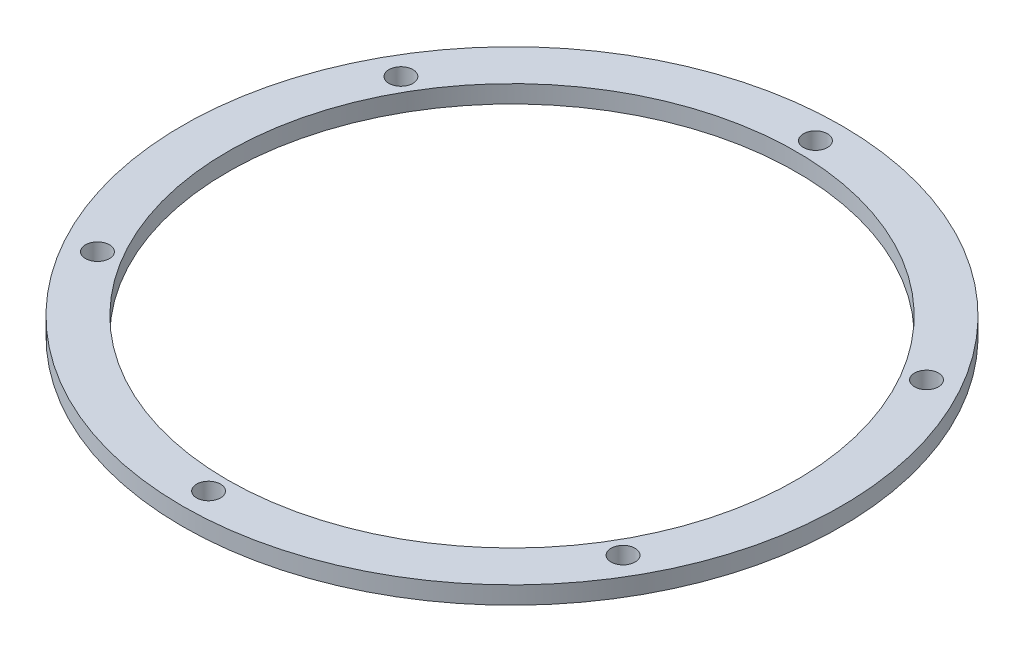
from build123d import *

# Parameters (mm, degrees)
SKETCH1_R           = 59.309
SKETCH1_R_2         = 51.181
BOSS_EXTRUDE1_DEPTH = 3.175
CUT_EXTRUDE1_REACH  = 85.936
SKETCH2_R           = 2.159
CIRPATTERN1_COUNT   = 6


with BuildPart() as part:
    # Sketch1 → Boss-Extrude1 (new body)
    with BuildSketch(Plane(origin=(0, 0, 0), x_dir=(1, 0, 0), z_dir=(0, 1, 0))):
        Circle(SKETCH1_R)
        Circle(SKETCH1_R_2, mode=Mode.SUBTRACT)
    extrude(amount=BOSS_EXTRUDE1_DEPTH)

    # Sketch2 → Cut-Extrude1 (cut, up to next)
    with BuildSketch(Plane(origin=(0, 3.175, 0), x_dir=(1, 0, 0), z_dir=(0, 1, 0)), mode=Mode.PRIVATE) as cut_extrude1_sk1:
        with Locations((0, 54.61)):
            Circle(SKETCH2_R)
    cut_extrude1_tool1 = extrude(cut_extrude1_sk1.sketch, amount=-CUT_EXTRUDE1_REACH, mode=Mode.PRIVATE) & part.part
    cut_extrude1 = cut_extrude1_tool1.solids().sort_by_distance((0, 3.175, -54.61))[0]
    add(cut_extrude1, mode=Mode.SUBTRACT)

    # CirPattern1: Cut-Extrude1 ×6 about axis
    cirpattern1_axis = Axis((0, 3.175, 0), (0, -1, 0))
    for i in range(1, CIRPATTERN1_COUNT):
        add(cut_extrude1.rotate(cirpattern1_axis, i * 360 / CIRPATTERN1_COUNT), mode=Mode.SUBTRACT)


solid = part.part
